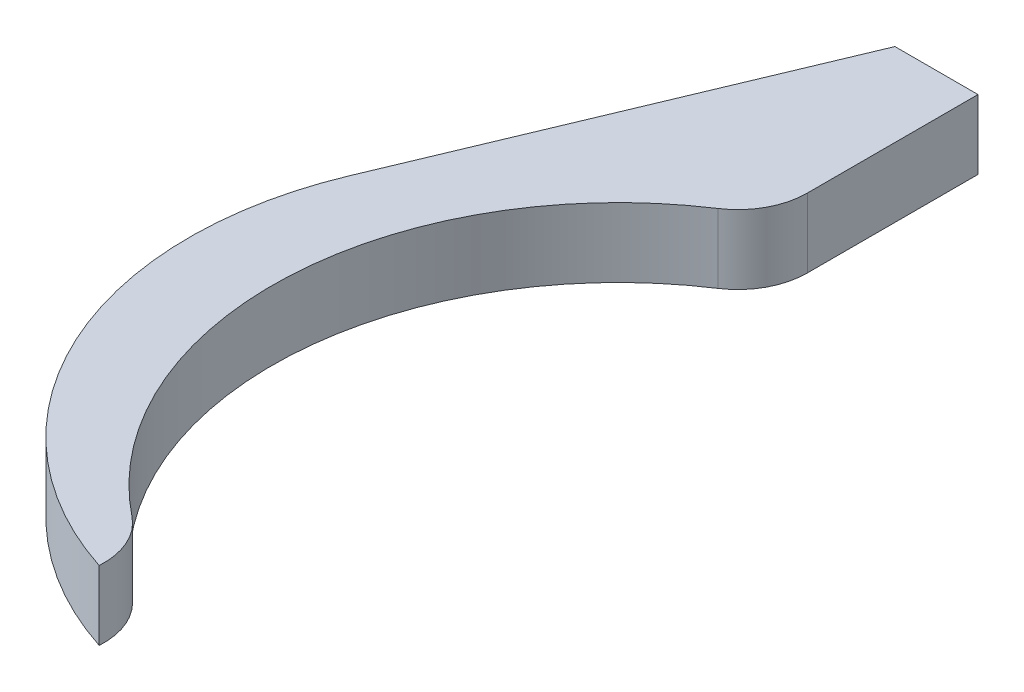
from build123d import *

# Parameters (mm, degrees)
EXTRUDE_2_DEPTH     = 5
SKETCH_4_R          = 1.65
CUT_EXTRUDE_1_DEPTH = 5
EXTRUDE_3_DEPTH     = 5
CUT_EXTRUDE_START   = -4.5
SKETCH_7_R          = 3
CUT_EXTRUDE_2_DEPTH = 3
CUT_EXTRUDE_3_DEPTH = 7.5
EXTRUDE_4_DEPTH     = 5
FILLET_1_R          = 5
FILLET_2_R          = 5
CUT_EXTRUDE_START_2 = -5
CUT_EXTRUDE_5_DEPTH = 5


with BuildPart() as part:
    # 草图3 → 凸台-拉伸2 (new body)
    with BuildSketch(Plane(origin=(0, 0, 0), x_dir=(1, 0, 0), z_dir=(0, 1, 0))):
        with BuildLine():
            Line((-3, -3.354101966), (-3, -7.416198487))
            Line((-3, -7.416198487), (-3, -43.854101966))
            Line((-3, -43.854101966), (3, -43.854101966))
            Line((3, -43.854101966), (3, -10.583005244))
            Line((3, -10.583005244), (3, -7.416198487))
            Line((3, -7.416198487), (3, -3.354101966))
            ThreePointArc((3, -3.354101966), (0, 4.5), (-3, -3.354101966))
        make_face()
    extrude(amount=EXTRUDE_2_DEPTH)

    # 草图4 → 切除-拉伸1 (cut)
    with BuildSketch(Plane(origin=(0, 5, 0), x_dir=(1, 0, 0), z_dir=(0, 1, 0))):
        with Locations(Location((0, 0, 0), (0, 0, 270))):
            Circle(SKETCH_4_R)
    extrude(amount=-CUT_EXTRUDE_1_DEPTH, mode=Mode.SUBTRACT)

    # 草图6 → 凸台-拉伸3 (add)
    with BuildSketch(Plane(origin=(0, 5, 0), x_dir=(1, 0, 0), z_dir=(0, 1, 0))):
        with BuildLine():
            Line((3, -33.74604712), (-3, -33.74604712))
            ThreePointArc((-3, -33.74604712), (-16.46902092, -57.986607816), (0.722500961, -79.745993902))
            Line((0.722500961, -79.745993902), (1.949520222, -77.620734201))
            ThreePointArc((1.949520222, -77.620734201), (-10.543317179, -55.371702353), (3, -33.74604712))
        make_face()
    extrude(amount=-EXTRUDE_3_DEPTH)

    # 草图7 → 切除-拉伸2 (cut)
    with BuildSketch(Plane(origin=(0, 5, 0), x_dir=(1, 0, 0), z_dir=(0, 1, 0)).offset(CUT_EXTRUDE_START)):
        with Locations(Location((0, 0, 0), (0, 0, 270))):
            Circle(SKETCH_7_R)
    extrude(amount=-CUT_EXTRUDE_2_DEPTH, mode=Mode.SUBTRACT)

    # 草图8 → 切除-拉伸3 (cut)
    with BuildSketch(Plane(origin=(0, 5, 0), x_dir=(1, 0, 0), z_dir=(0, 1, 0))):
        with BuildLine():
            Line((-3, -38.067187498), (-3, -43.854101966))
            Line((-3, -43.854101966), (3, -43.854101966))
            Line((3, -43.854101966), (3, -33.74604712))
            ThreePointArc((3, -33.74604712), (-0.160637142, -35.683569047), (-3, -38.067187498))
        make_face()
    extrude(amount=-CUT_EXTRUDE_3_DEPTH, mode=Mode.SUBTRACT)

    # 草图9 → 凸台-拉伸4 (add)
    with BuildSketch(Plane(origin=(0, 5, 0), x_dir=(1, 0, 0), z_dir=(0, 1, 0))):
        with BuildLine():
            Line((-3, -18.550074543), (-14.614967684, -46.324924269))
            ThreePointArc((-14.614967684, -46.324924269), (-9.917875534, -39.010182445), (-3, -33.74604712))
            Line((-3, -33.74604712), (-3, -18.550074543))
        make_face()
    extrude(amount=-EXTRUDE_4_DEPTH)

    # 圆角1
    fillet_1_edges = [part.edges().sort_by_distance(p)[0] for p in [
        (3, 2.5, 33.74604712),
    ]]
    fillet(fillet_1_edges, radius=FILLET_1_R)

    # 圆角2
    # the kernel refuses this fillet: 5 mm, written as the material it takes off along each edge
    with BuildSketch(Plane(origin=(1.949520222, 14.371610933, 77.620734201), x_dir=(-0.8261015944022844, 0, -0.5635212114250925), z_dir=(0, -1, 0))) as fillet_2_piece_1:
        with BuildLine():
            CenterArc((4.123508811, -4.985927863), FILLET_2_R, 94.299664485, 55.185648669)
            Line((-0.183986354, -2.447131808), (-0.270136257, -2.396355887))
            ThreePointArc((-0.270136257, -2.396355887), (-0.191711734, -1.216068615), (-0.099718557, 0.007497289))
            Line((-0.099718557, 0.007497289), (0.007497289, 0.099718557))
            ThreePointArc((0.007497289, 0.099718557), (1.874322187, 0.029639314), (3.741147084, 0.099718557))
            Line((3.741147084, 0.099718557), (3.748644373, 0))
        make_face()
    extrude(amount=23.743221866, mode=Mode.SUBTRACT)

    # 草图10 → 切除-拉伸5 (cut)
    with BuildSketch(Plane(origin=(0, 5, 0), x_dir=(1, 0, 0), z_dir=(0, 1, 0)).offset(CUT_EXTRUDE_START_2)):
        with BuildLine():
            Line((-3, -18.550074543), (3, -18.550074543))
            Line((3, -18.550074543), (3, -3.354101966))
            ThreePointArc((3, -3.354101966), (0, 4.5), (-3, -3.354101966))
            Line((-3, -3.354101966), (-3, -18.550074543))
        make_face()
    extrude(amount=CUT_EXTRUDE_5_DEPTH, mode=Mode.SUBTRACT)


solid = part.part
